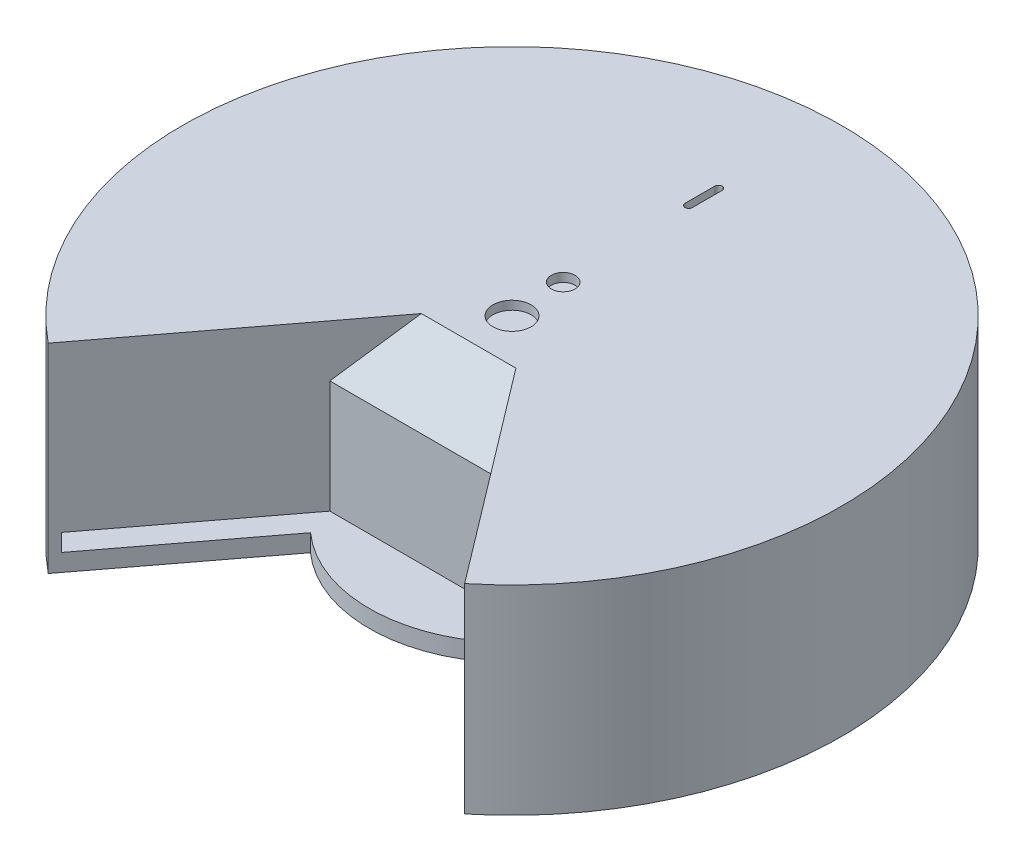
from build123d import *

# Parameters (mm, degrees)
SKETCH_1_R                = 190
EXTRUDE_1_DEPTH           = 10
SKETCH_2_R                = 11
CUT_EXTRUDE_1_DEPTH       = 10
CUT_EXTRUDE_2_DEPTH       = 10
CUT_EXTRUDE_3_DEPTH       = 10
SKETCH_5_R                = 11.5
CUT_EXTRUDE_4_DEPTH       = 2
EXTRUDE_2_DEPTH           = 100
EXTRUDE_3_DEPTH           = 5
CUT_EXTRUDE_START         = -5
SKETCH_11_R               = 11
CUT_EXTRUDE_7_DEPTH       = 5
SKETCH_12_W               = 100
SKETCH_12_H               = 115
EXTRUDE_4_DEPTH           = 5
EXTRUDE_5_DEPTH           = 115
CUT_EXTRUDE_8_DEPTH       = 289.487434735
SKETCH_15_W               = 110
SKETCH_15_H               = 10
CUT_EXTRUDE_9_DEPTH       = 23
SKETCH_16_W               = 110
SKETCH_16_H               = 10
CUT_EXTRUDE_10_DEPTH      = 23
EXTRUDE_6_DEPTH           = 10
SKETCH_18_R               = 10
EXTRUDE_7_DEPTH           = 100
SKETCH_20_W               = 40.15762627
SKETCH_20_H               = 37.957208392
EXTRUDE_8_DEPTH           = 20
CUT_EXTRUDE_11_DEPTH      = 70
SKETCH_22_W               = 6
SKETCH_22_H               = 39.800206828
SKETCH_24_R               = 10.715541735
EXTRUDE_9_DEPTH           = 50
SKETCH_25_R               = 8.111462828
CUT_EXTRUDE_13_DEPTH      = 1
FILLET_2_R                = 3
SKETCH_26_W               = 20.914862296
SKETCH_26_H               = 66.390296829
CUT_EXTRUDE_14_DEPTH      = 41
EXTRUDE_START             = -5
EXTRUDE_10_DEPTH          = 5
CUT_EXTRUDE_15_DEPTH      = 369.496652909
CUT_EXTRUDE_15_DEPTH_BACK = 369.496652909
SKETCH_28_W               = 81.996426071
SKETCH_28_H               = 91.436240801
EXTRUDE_11_DEPTH          = 142
SKETCH_30_W               = 61.807944975
SKETCH_30_H               = 65.134221846
EXTRUDE_12_DEPTH          = 5
FILLET_4_R                = 13
SKETCH_31_W               = 61.807944975
SKETCH_31_H               = 147
EXTRUDE_13_DEPTH          = 70
SKETCH_32_W               = 51.807944975
SKETCH_32_H               = 142
CUT_EXTRUDE_16_DEPTH      = 60
FILLET_5_R                = 13
FILLET_6_R                = 13
CUT_EXTRUDE_17_DEPTH      = 60
CUT_EXTRUDE_18_DEPTH      = 60
EXTRUDE_START_2           = -75
SKETCH_35_W               = 61.807944975
SKETCH_35_H               = 6.562212177
EXTRUDE_14_DEPTH          = 75
CUT_EXTRUDE_19_DEPTH      = 60
CUT_EXTRUDE_START_2       = 70
CUT_EXTRUDE_20_DEPTH      = 70
SKETCH_40_R               = 6.852948308
CUT_EXTRUDE_24_DEPTH      = 10
CHAMFER_1_SIZE            = 30
CHAMFER_2_SIZE            = 30
CUT_EXTRUDE_25_DEPTH      = 216
CUT_EXTRUDE_26_DEPTH      = 10
CUT_EXTRUDE_26_DEPTH_BACK = 20
SKETCH_42_W               = 161.925382199
SKETCH_42_H               = 10
SKETCH_43_W               = 20
SKETCH_43_H               = 45
EXTRUDE_15_DEPTH          = 100
SKETCH_44_W               = 60
SKETCH_44_H               = 45
EXTRUDE_16_DEPTH          = 26


# Read off the part's stored shape, not the designer's step: 圆顶1
with BuildPart() as part:
    # 草图1 → 凸台-拉伸1 (new body)
    with BuildSketch(Plane(origin=(0, 0, 0), x_dir=(1, 0, 0), z_dir=(0, 1, 0))):
        with Locations(Location((0, 0, 0), (0, 0, 270))):
            Circle(SKETCH_1_R)
    extrude(amount=EXTRUDE_1_DEPTH)

    # 草图2 → 切除-拉伸1 (cut)
    with BuildSketch(Plane(origin=(0, 10, 0), x_dir=(1, 0, 0), z_dir=(0, 1, 0))):
        with Locations(Location((0, 0, 0), (0, 0, 270))):
            Circle(SKETCH_2_R)
    extrude(amount=-CUT_EXTRUDE_1_DEPTH, mode=Mode.SUBTRACT)

    # 草图3 → 切除-拉伸2 (cut)
    with BuildSketch(Plane(origin=(0, 10, 0), x_dir=(1, 0, 0), z_dir=(0, 1, 0))):
        Polygon((-50, -50), (-120, -147.309198627), (120, -147.309198627), (50, -50), align=None)
    extrude(amount=-CUT_EXTRUDE_2_DEPTH, mode=Mode.SUBTRACT)

    # 草图4 → 切除-拉伸3 (cut)
    with BuildSketch(Plane(origin=(0, 10, 0), x_dir=(1, 0, 0), z_dir=(0, 1, 0))):
        Polygon((50, -50), (136.06201209, -169.637506124), (-54.476164161, -215.928987862), (-150.534220248, -169.637506124), (-120, -147.309198627), (-80.889727825, -92.940780863), align=None)
    extrude(amount=-CUT_EXTRUDE_3_DEPTH, mode=Mode.SUBTRACT)

    # 草图5 → 切除-拉伸4 (cut)
    with BuildSketch(Plane(origin=(0, 10, 0), x_dir=(1, 0, 0), z_dir=(0, 1, 0))):
        with Locations(Location((0, 31.5, 0), (0, 0, 270))):
            Circle(SKETCH_5_R)
    extrude(amount=-CUT_EXTRUDE_4_DEPTH, mode=Mode.SUBTRACT)

    # 草图9 → 凸台-拉伸2 (add)
    with BuildSketch(Plane(origin=(0, 10, 0), x_dir=(1, 0, 0), z_dir=(0, 1, 0))):
        with BuildLine():
            Line((50, -50), (120, -147.309198627))
            ThreePointArc((120, -147.309198627), (0, 190), (-120, -147.309198627))
            Line((-120, -147.309198627), (-50, -50))
            Line((-50, -50), (50, -50))
        make_face()
        with BuildLine():
            Line((52.56250687, -45), (120.913822869, -140.017311213))
            ThreePointArc((120.913822869, -140.017311213), (0, 185), (-120.913822869, -140.017311213))
            Line((-120.913822869, -140.017311213), (-52.56250687, -45))
            Line((-52.56250687, -45), (52.56250687, -45))
        make_face(mode=Mode.SUBTRACT)
    extrude(amount=EXTRUDE_2_DEPTH)

    # 草图10 → 凸台-拉伸3 (add)
    with BuildSketch(Plane(origin=(0, 110, 0), x_dir=(1, 0, 0), z_dir=(0, 1, 0))):
        with BuildLine():
            Line((-50, -50), (50, -50))
            Line((50, -50), (120, -147.309198627))
            ThreePointArc((120, -147.309198627), (0, 190), (-120, -147.309198627))
            Line((-120, -147.309198627), (-50, -50))
        make_face()
    extrude(amount=EXTRUDE_3_DEPTH)

    # 草图11 → 切除-拉伸7 (cut)
    with BuildSketch(Plane.XZ.offset(-110).offset(CUT_EXTRUDE_START)):
        with Locations(Location((0, 0, 0), (0, 0, 90))):
            Circle(SKETCH_11_R)
    extrude(amount=CUT_EXTRUDE_7_DEPTH, mode=Mode.SUBTRACT)

    # 草图12 → 凸台-拉伸4 (add)
    with BuildSketch(Plane.XY.offset(50)):
        with Locations((0, 57.5)):
            Rectangle(SKETCH_12_W, SKETCH_12_H)
    extrude(amount=EXTRUDE_4_DEPTH)

    # 草图13 → 凸台-拉伸5 (add)
    with BuildSketch(Plane.XZ):
        Polygon((-120, 147.309198627), (-50, 55), (-50, 50), align=None)
        Polygon((50, 50), (120, 147.309198627), (50, 55), align=None)
    extrude(amount=-EXTRUDE_5_DEPTH)

    # 草图14 → 切除-拉伸8 (cut, through all)
    with BuildSketch(Plane(origin=(0, 10, 0), x_dir=(1, 0, 0), z_dir=(0, 1, 0))):
        with BuildLine():
            Line((-175, 60), (175, 60))
            ThreePointArc((175, 60), (0, 185), (-175, 60))
        make_face()
    extrude(amount=CUT_EXTRUDE_8_DEPTH, mode=Mode.SUBTRACT)

    # 草图15 → 切除-拉伸9 (cut)
    with BuildSketch(Plane(origin=(-13.305974514, 0, -9.571738635), x_dir=(-0.5839606140594331, 0, 0.8117819911942675), z_dir=(-0.8117819911942675, 0, -0.5839606140594331))):
        with Locations((129.272441949, 15)):
            Rectangle(SKETCH_15_W, SKETCH_15_H)
    extrude(amount=-CUT_EXTRUDE_9_DEPTH, mode=Mode.SUBTRACT)

    # 草图16 → 切除-拉伸10 (cut)
    with BuildSketch(Plane(origin=(13.305974514, 0, -9.571738635), x_dir=(-0.5839606140594333, 0, -0.8117819911942674), z_dir=(0.8117819911942673, 0, -0.5839606140594332))):
        with Locations((-129.272441949, 15)):
            Rectangle(SKETCH_16_W, SKETCH_16_H)
    extrude(amount=-CUT_EXTRUDE_10_DEPTH, mode=Mode.SUBTRACT)

    # 草图17 → 凸台-拉伸6 (add)
    with BuildSketch(Plane.XZ):
        with BuildLine():
            Line((-68.721971502, 45.192401274), (70.16486598, 42.91799252))
            ThreePointArc((70.16486598, 42.91799252), (1.34674419, 82.238973608), (-68.721971502, 45.192401274))
        make_face()
    extrude(amount=-EXTRUDE_6_DEPTH)

    # 草图18 → 凸台-拉伸7 (add)
    with BuildSketch(Plane(origin=(0, 115, 0), x_dir=(1, 0, 0), z_dir=(0, 1, 0))):
        with Locations(Location((0, 46.854928923, 0), (0, 0, 90))):
            Circle(SKETCH_18_R)
    extrude(amount=EXTRUDE_7_DEPTH)

    # 草图20 → 凸台-拉伸8 (add)
    with BuildSketch(Plane(origin=(0, 215, 0), x_dir=(1, 0, 0), z_dir=(0, 1, 0))):
        with Locations((-0.847426087, 46.622471939)):
            Rectangle(SKETCH_20_W, SKETCH_20_H)
    extrude(amount=EXTRUDE_8_DEPTH)

    # 草图21 → 切除-拉伸11 (cut)
    with BuildSketch(Plane.ZY.offset(20.926239222)):
        Polygon((-54.791741718, 236.72389037), (-19.944006341, 217.982251176), (-19.065492004, 240.530785832), align=None)
    extrude(amount=-CUT_EXTRUDE_11_DEPTH, mode=Mode.SUBTRACT)

    # 草图22 → 旋转1 (revolve)
    with BuildSketch(Plane(origin=(0, 160.757687824, 86.457916141), x_dir=(1, 0, 0), z_dir=(0, 0.8807086333026608, 0.4736584246333635)), mode=Mode.PRIVATE) as revolve_1_sk:
        with Locations((1.240539722, 142.968257651)):
            Rectangle(SKETCH_22_W, SKETCH_22_H)
    revolve(revolve_1_sk.sketch.rotate(Axis((-1.759460278, 237.901659149, -56.981655541), (0, -0.47365842463336366, 0.8807086333026606)), 90), axis=Axis((-1.759460278, 237.901659149, -56.981655541), (0, -0.47365842463336366, 0.8807086333026606)))

    # 草图24 → 凸台-拉伸9 (add)
    with BuildSketch(Plane(origin=(0, 58.292268059, -108.387185922), x_dir=(1, 0, 0), z_dir=(0, -0.4736584246333635, 0.8807086333026606))):
        with Locations(Location((-1.759460278, 182.532203893, 0), (0, 0, 270))):
            Circle(SKETCH_24_R)
    extrude(amount=-EXTRUDE_9_DEPTH)

    # 草图25 → 切除-拉伸13 (cut)
    with BuildSketch(Plane(origin=(0, 58.292268059, -108.387185922), x_dir=(1, 0, 0), z_dir=(0, -0.4736584246333635, 0.8807086333026606))):
        with Locations(Location((-1.759460278, 182.532203893, 0), (0, 0, 270))):
            Circle(SKETCH_25_R)
    extrude(amount=-CUT_EXTRUDE_13_DEPTH, mode=Mode.SUBTRACT)

    # 圆角2
    fillet_2_edges = [part.edges().sort_by_distance(p)[0] for p in [
        (0, 115, -36.854928923),
    ]]
    fillet(fillet_2_edges, radius=FILLET_2_R)

    # 草图26 → 切除-拉伸14 (cut)
    with BuildSketch(Plane(origin=(0, 160.757687824, 86.457916141), x_dir=(1, 0, 0), z_dir=(0, 0.8807086333026608, 0.4736584246333635))):
        with Locations((27.855490238, 146.001600843)):
            Rectangle(SKETCH_26_W, SKETCH_26_H)
    extrude(amount=-CUT_EXTRUDE_14_DEPTH, mode=Mode.SUBTRACT)

    # 草图27 → 凸台-拉伸10 (add)
    with BuildSketch(Plane(origin=(0, 115, 0), x_dir=(1, 0, 0), z_dir=(0, 1, 0)).offset(EXTRUDE_START)):
        with BuildLine():
            Line((-175, 60), (175, 60))
            ThreePointArc((175, 60), (0, 185), (-175, 60))
        make_face()
    extrude(amount=EXTRUDE_10_DEPTH)

    # 草图28 → 切除-拉伸15 (cut, two sides: drawn at the far end of the back side and taken through both)
    with BuildSketch(Plane(origin=(0, 0, 0), x_dir=(0, 0, -1), z_dir=(1, 0, 0)).offset(-CUT_EXTRUDE_15_DEPTH_BACK)):
        with Locations((192.841193776, 59.465903433)):
            Rectangle(SKETCH_28_W, SKETCH_28_H)
    extrude(amount=CUT_EXTRUDE_15_DEPTH + CUT_EXTRUDE_15_DEPTH_BACK, mode=Mode.SUBTRACT)

    # 草图29 → 凸台-拉伸11 (add)
    with BuildSketch(Plane(origin=(0, 115, 0), x_dir=(1, 0, 0), z_dir=(0, 1, 0))):
        Polygon((-32.985541705, 83.704196909), (-32.985541705, 18.569975063), (-27.985541705, 18.569975063), (-27.985541705, 78.704196909), (23.82240327, 78.704196909), (23.82240327, 18.569975063), (28.82240327, 18.569975063), (28.82240327, 83.704196909), align=None)
    extrude(amount=EXTRUDE_11_DEPTH)

    # 草图30 → 凸台-拉伸12 (add)
    with BuildSketch(Plane(origin=(0, 257, 0), x_dir=(1, 0, 0), z_dir=(0, 1, 0))):
        with Locations((-2.081569218, 51.137085986)):
            Rectangle(SKETCH_30_W, SKETCH_30_H)
    extrude(amount=EXTRUDE_12_DEPTH)

    # 圆角4
    fillet_4_edges = [part.edges().sort_by_distance(p)[0] for p in [
        (-27.985541705, 257, -48.637085986),
        (23.82240327, 257, -48.637085986),
    ]]
    fillet(fillet_4_edges, radius=FILLET_4_R)

    # 草图31 → 凸台-拉伸13 (add)
    with BuildSketch(Plane(origin=(0, 0, -83.704196909), x_dir=(-1, 0, 0), z_dir=(0, 0, -1))):
        with Locations((2.081569218, 188.5)):
            Rectangle(SKETCH_31_W, SKETCH_31_H)
    extrude(amount=EXTRUDE_13_DEPTH)

    # 草图32 → 切除-拉伸16 (cut)
    with BuildSketch(Plane(origin=(0, 0, -153.704196909), x_dir=(-1, 0, 0), z_dir=(0, 0, -1))):
        with Locations((2.081569218, 186)):
            Rectangle(SKETCH_32_W, SKETCH_32_H)
    extrude(amount=-CUT_EXTRUDE_16_DEPTH, mode=Mode.SUBTRACT)

    # 圆角5
    fillet_5_edges = [part.edges().sort_by_distance(p)[0] for p in [
        (-32.985541705, 262, -86.137085986),
        (28.82240327, 262, -86.137085986),
    ]]
    fillet(fillet_5_edges, radius=FILLET_5_R)

    # 圆角6
    fillet_6_edges = [part.edges().sort_by_distance(p)[0] for p in [
        (23.82240327, 257, -123.704196909),
        (-27.985541705, 257, -123.704196909),
    ]]
    fillet(fillet_6_edges, radius=FILLET_6_R)

    # 草图33 → 切除-拉伸17 (cut)
    with BuildSketch(Plane.XY.offset(-78.704196909)):
        with BuildLine():
            Line((13.892318938, 199.249147057), (13.892318938, 143.139086494))
            ThreePointArc((13.892318938, 143.139086494), (0, 129.246767556), (-13.892318938, 143.139086494))
            Line((-13.892318938, 143.139086494), (-13.892318938, 199.249147057))
            ThreePointArc((-13.892318938, 199.249147057), (0, 213.141465996), (13.892318938, 199.249147057))
        make_face()
    extrude(amount=-CUT_EXTRUDE_17_DEPTH, mode=Mode.SUBTRACT)

    # 草图34 → 切除-拉伸18 (cut)
    with BuildSketch(Plane(origin=(0, 115, 0), x_dir=(1, 0, 0), z_dir=(0, 1, 0))):
        with BuildLine():
            Line((-6.290976551, 106.02597296), (-6.290976551, 123.135910488))
            ThreePointArc((-6.290976551, 123.135910488), (-4.165768662, 125.261118376), (-2.040560774, 123.135910488))
            Line((-2.040560774, 123.135910488), (-2.040560774, 106.02597296))
            ThreePointArc((-2.040560774, 106.02597296), (-4.165768662, 103.900765071), (-6.290976551, 106.02597296))
        make_face()
    extrude(amount=-CUT_EXTRUDE_18_DEPTH, mode=Mode.SUBTRACT)

    # 草图35 → 凸台-拉伸14 (add)
    with BuildSketch(Plane(origin=(0, 0, -153.704196909), x_dir=(-1, 0, 0), z_dir=(0, 0, -1)).offset(EXTRUDE_START_2)):
        with Locations((2.081569218, 185.281106088)):
            Rectangle(SKETCH_35_W, SKETCH_35_H)
    extrude(amount=EXTRUDE_14_DEPTH)

    # 草图36 → 切除-拉伸19 (cut)
    with BuildSketch(Plane(origin=(0, 188.562212177, 0), x_dir=(1, 0, 0), z_dir=(0, 1, 0))):
        with BuildLine():
            Line((-6.290976551, 123.135910488), (-6.290976551, 106.02597296))
            ThreePointArc((-6.290976551, 106.02597296), (-4.165768662, 103.900765071), (-2.040560774, 106.02597296))
            Line((-2.040560774, 106.02597296), (-2.040560774, 123.135910488))
            ThreePointArc((-2.040560774, 123.135910488), (-4.165768662, 125.261118376), (-6.290976551, 123.135910488))
        make_face()
    extrude(amount=-CUT_EXTRUDE_19_DEPTH, mode=Mode.SUBTRACT)

    # 圆顶1 outline → 圆顶1 (revolve)
    with BuildSketch(Plane(origin=(-1.759460278, 160.757687824, 86.457916141), x_dir=(1, 0, 0), z_dir=(0, 0.880708633302661, 0.473658424633363))):
        with BuildLine():
            Line((0, 124.068154246), (0, 119.068154237))
            ThreePointArc((0, 119.068154237), (4.764342278, 120.41858011), (8.111462832, 124.068154246))
            Line((8.111462832, 124.068154246), (0, 124.068154246))
        make_face()
    revolve(axis=Axis((-1.759460278, 160.757687824, 86.457916141), (0, 0.473658424633363, -0.880708633302661)))

    # 草图37 → 切除-拉伸20 (cut)
    with BuildSketch(Plane.XY.offset(-78.704196909).offset(CUT_EXTRUDE_START_2)):
        with BuildLine():
            Line((-27.985541705, 115), (23.82240327, 115))
            Line((23.82240327, 115), (23.82240327, 244))
            ThreePointArc((23.82240327, 244), (20.014791425, 253.192388155), (10.82240327, 257))
            Line((10.82240327, 257), (-14.985541705, 257))
            ThreePointArc((-14.985541705, 257), (-24.177929861, 253.192388155), (-27.985541705, 244))
            Line((-27.985541705, 244), (-27.985541705, 115))
        make_face()
    extrude(amount=-CUT_EXTRUDE_20_DEPTH, mode=Mode.SUBTRACT)

    # 草图40 → 切除-拉伸24 (cut)
    with BuildSketch(Plane(origin=(0, 115, 0), x_dir=(1, 0, 0), z_dir=(0, 1, 0))):
        with Locations(Location((-2.06616942, 31.55452141, 0), (0, 0, 270))):
            Circle(SKETCH_40_R)
    extrude(amount=-CUT_EXTRUDE_24_DEPTH, mode=Mode.SUBTRACT)

    # 倒角1
    chamfer_1_edges = [part.edges().sort_by_distance(p)[0] for p in [
        (0, 115, 55),
    ]]
    chamfer(chamfer_1_edges, length=CHAMFER_1_SIZE)

    # 倒角2
    chamfer_2_edges = [part.edges().sort_by_distance(p)[0] for p in [
        (0, 110, 45),
    ]]
    chamfer(chamfer_2_edges, length=CHAMFER_2_SIZE)

    # 草图41 → 切除-拉伸25 (cut)
    with BuildSketch(Plane(origin=(0, 115, 0), x_dir=(1, 0, 0), z_dir=(0, 1, 0))):
        with BuildLine():
            Line((-120, -147.309198627), (-27.250371239, -25))
            Line((-27.250371239, -25), (27.250371239, -25))
            Line((27.250371239, -25), (120, -147.309198627))
            ThreePointArc((120, -147.309198627), (0, 190), (-120, -147.309198627))
        make_face()
    extrude(amount=CUT_EXTRUDE_25_DEPTH, mode=Mode.SUBTRACT)

    # 草图42 → 切除-拉伸26 (cut, two sides: drawn at the far end of the back side and taken through both)
    with BuildSketch(Plane.XY.offset(55).offset(-CUT_EXTRUDE_26_DEPTH_BACK)):
        with Locations((4.31271157, 15)):
            Rectangle(SKETCH_42_W, SKETCH_42_H)
    extrude(amount=CUT_EXTRUDE_26_DEPTH + CUT_EXTRUDE_26_DEPTH_BACK, mode=Mode.SUBTRACT)

    # 草图43 → 凸台-拉伸15 (add)
    with BuildSketch(Plane(origin=(0, 0, 45), x_dir=(-1, 0, 0), z_dir=(0, 0, -1))):
        with Locations((-20, 47.5)):
            Rectangle(SKETCH_43_W, SKETCH_43_H)
        with Locations((20, 47.5)):
            Rectangle(SKETCH_43_W, SKETCH_43_H)
    extrude(amount=EXTRUDE_15_DEPTH)

    # 草图44 → 凸台-拉伸16 (add)
    with BuildSketch(Plane(origin=(0, 0, 45), x_dir=(-1, 0, 0), z_dir=(0, 0, -1))):
        with Locations((0, 47.5)):
            Rectangle(SKETCH_44_W, SKETCH_44_H)
    extrude(amount=EXTRUDE_16_DEPTH)


solid = part.part
